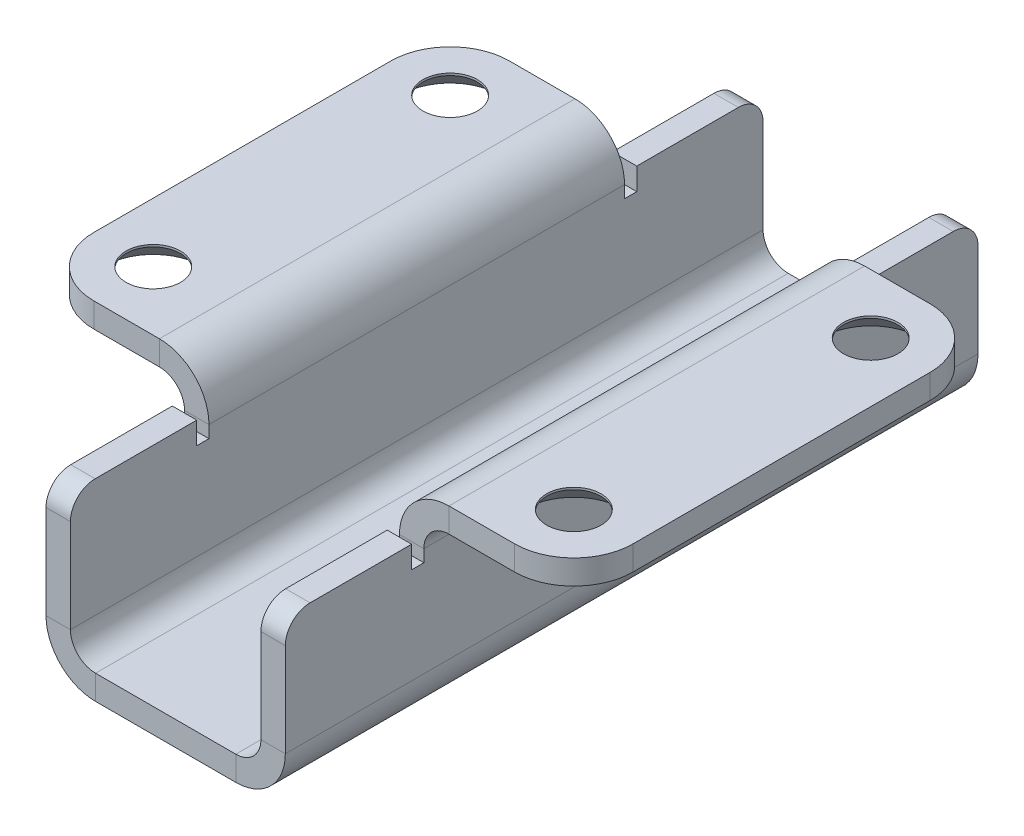
from build123d import *

# Parameters (mm, degrees)
SKETCH1_W                                     = 38.5
SKETCH1_H                                     = 140
BASE_FLANGE1_DEPTH                            = 4.93522
EDGE_FLANGE1_STRIP_W                          = 29.90088
EDGE_FLANGE1_STRIP_H                          = 4.93522
EDGE_FLANGE1_STRIP_CUT_DEPTH                  = 140
EDGE_FLANGE1_DEPTH                            = 140
EDGE_FLANGE2_STRIP_W                          = 29.90088
EDGE_FLANGE2_STRIP_H                          = 4.93522
EDGE_FLANGE2_STRIP_CUT_DEPTH                  = 84
EDGE_FLANGE2_RELIEF_W                         = 32.36849
EDGE_FLANGE2_RELIEF_H                         = 2.46761
EDGE_FLANGE2_RELIEF_CUT_DEPTH                 = 4.93522
EDGE_FLANGE2_DEPTH                            = 84
FILLET1_R                                     = 12
CUT_EXTRUDE1_REACH                            = 92.308
SKETCH20_W                                    = 25.53239
SKETCH20_H                                    = 8
FILLET2_R                                     = 5
FILLET1_OF_MIRROR1_R                          = 12
FILLET2_OF_MIRROR1_R                          = 5
CSK_FOR_M10_FLAT_HEAD_MACHINE_SCREW1_AT_COUNT = 2
CSK_FOR_M10_FLAT_HEAD_MACHINE_SCREW1_AT_PITCH = 52.021630117
CSK_FOR_M10_FLAT_HEAD_MACHINE_SCREW1_2_COUNT  = 2
CSK_FOR_M10_FLAT_HEAD_MACHINE_SCREW1_2_PITCH  = 104.043260233
CSK_FOR_M10_FLAT_HEAD_MACHINE_SCREW1_3_COUNT  = 2
CSK_FOR_M10_FLAT_HEAD_MACHINE_SCREW1_3_PITCH  = 85
CSK_FOR_M10_FLAT_HEAD_MACHINE_SCREW1_4_COUNT  = 2
CSK_FOR_M10_FLAT_HEAD_MACHINE_SCREW1_4_PITCH  = 60


# Sheet-metal steps are written as plain solids
with BuildPart() as part:
    # Sketch1 → Base-Flange1 (new body)
    with BuildSketch(Plane(origin=(0, 0, 0), x_dir=(1, 0, 0), z_dir=(0, 1, 0))):
        Rectangle(SKETCH1_W, SKETCH1_H)
    extrude(amount=-BASE_FLANGE1_DEPTH)

    # Edge-Flange1 strip (across the edge) → Edge-Flange1 strip cut (cut)
    with BuildSketch(Plane(origin=(-19.25, 0, -70), x_dir=(1, 0, 0), z_dir=(0, 0, 1))):
        with Locations((-9.87044, -2.46761)):
            Rectangle(EDGE_FLANGE1_STRIP_W, EDGE_FLANGE1_STRIP_H)
    edge_flange1_strip_cut = extrude(amount=EDGE_FLANGE1_STRIP_CUT_DEPTH, mode=Mode.SUBTRACT)

    # Edge-Flange1 section (across the edge) → Edge-Flange1 (add)
    with BuildSketch(Plane(origin=(-19.25, 0, -70), x_dir=(1, 0, 0), z_dir=(0, 0, 1))):
        with BuildLine():
            Line((-4.93522, 5.08), (-4.93522, 37))
            Line((-4.93522, 37), (0, 37))
            Line((0, 37), (0, 5.08))
            ThreePointArc((0, 5.08), (1.487897552, 1.487897552), (5.08, 0))
            Line((5.08, 0), (5.08, -4.93522))
            ThreePointArc((5.08, -4.93522), (-2.001829977, -2.001829977), (-4.93522, 5.08))
        make_face()
    edge_flange1 = extrude(amount=EDGE_FLANGE1_DEPTH)

    # Edge-Flange2 strip (across the edge) → Edge-Flange2 strip cut (cut)
    with BuildSketch(Plane(origin=(-24.18522, 37, 42), x_dir=(0, -1, 0), z_dir=(0, 0, -1))):
        with Locations((-4.93522, -2.46761)):
            Rectangle(EDGE_FLANGE2_STRIP_W, EDGE_FLANGE2_STRIP_H)
    edge_flange2_strip_cut = extrude(amount=EDGE_FLANGE2_STRIP_CUT_DEPTH, mode=Mode.SUBTRACT)

    # Edge-Flange2 relief (on the sheet) → Edge-Flange2 relief cut (cut)
    with BuildSketch(Plane(origin=(-24.18522, 26.98478, 42), x_dir=(0, -1, 0), z_dir=(-1, 0, 0))):
        with Locations((-13.716635, 1.233805)):
            Rectangle(EDGE_FLANGE2_RELIEF_W, EDGE_FLANGE2_RELIEF_H)
        with Locations((-13.716635, -85.233805)):
            Rectangle(EDGE_FLANGE2_RELIEF_W, EDGE_FLANGE2_RELIEF_H)
    edge_flange2_relief_cut = extrude(amount=-EDGE_FLANGE2_RELIEF_CUT_DEPTH, mode=Mode.SUBTRACT)

    # Edge-Flange2 section (across the edge) → Edge-Flange2 (add)
    with BuildSketch(Plane(origin=(-24.18522, 37, 42), x_dir=(0, -1, 0), z_dir=(0, 0, -1))):
        with BuildLine():
            Line((0, 5.08), (0, 30.31478))
            Line((0, 30.31478), (4.93522, 30.31478))
            Line((4.93522, 30.31478), (4.93522, 5.08))
            ThreePointArc((4.93522, 5.08), (6.423117552, 1.487897552), (10.01522, 0))
            Line((10.01522, 0), (10.01522, -4.93522))
            ThreePointArc((10.01522, -4.93522), (2.933390023, -2.001829977), (0, 5.08))
        make_face()
    edge_flange2 = extrude(amount=EDGE_FLANGE2_DEPTH)

    # Fillet1
    fillet1_edges = [part.edges().sort_by_distance(p)[0] for p in [
        (-54.5, 34.53239, 42),
        (-54.5, 34.53239, -42),
    ]]
    fillet(fillet1_edges, radius=FILLET1_R)

    # Sketch20 → Cut-Extrude1 (cut, up to next)
    with BuildSketch(Plane.ZY.offset(24.18522), mode=Mode.PRIVATE) as cut_extrude1_sk1:
        with Locations((-57.233805, 33)):
            Rectangle(SKETCH20_W, SKETCH20_H)
    cut_extrude1_tool1 = extrude(cut_extrude1_sk1.sketch, amount=-CUT_EXTRUDE1_REACH, mode=Mode.PRIVATE) & part.part
    # Sketch20 → Cut-Extrude1 (cut, up to next)
    with BuildSketch(Plane.ZY.offset(24.18522), mode=Mode.PRIVATE) as cut_extrude1_sk2:
        with Locations((57.233805, 33)):
            Rectangle(SKETCH20_W, SKETCH20_H)
    cut_extrude1_tool2 = extrude(cut_extrude1_sk2.sketch, amount=-CUT_EXTRUDE1_REACH, mode=Mode.PRIVATE) & part.part
    cut_extrude1_1 = cut_extrude1_tool1.solids().sort_by_distance((-24.18522, 33, -57.233805))[0]
    add(cut_extrude1_1, mode=Mode.SUBTRACT)
    cut_extrude1_2 = cut_extrude1_tool2.solids().sort_by_distance((-24.18522, 33, 57.233805))[0]
    add(cut_extrude1_2, mode=Mode.SUBTRACT)
    cut_extrude1 = cut_extrude1_1 + cut_extrude1_2  # Cut-Extrude1 as one shape, for the pattern or mirror that repeats it

    # Fillet2
    fillet2_edges = [part.edges().sort_by_distance(p)[0] for p in [
        (-21.71761, 29, -70),
        (-21.71761, 29, 70),
    ]]
    fillet(fillet2_edges, radius=FILLET2_R)

    # Mirror1: Edge-Flange1 strip cut, Edge-Flange1, Edge-Flange2 strip cut, Edge-Flange2 relief cut, Edge-Flange2, Cut-Extrude1 across plane
    add(edge_flange1_strip_cut.mirror(Plane(origin=(0, 0, 0), x_dir=(0, 0, 1), z_dir=(1, 0, 0))), mode=Mode.SUBTRACT)
    add(edge_flange1.mirror(Plane(origin=(0, 0, 0), x_dir=(0, 0, 1), z_dir=(1, 0, 0))))
    add(edge_flange2_strip_cut.mirror(Plane(origin=(0, 0, 0), x_dir=(0, 0, 1), z_dir=(1, 0, 0))), mode=Mode.SUBTRACT)
    add(edge_flange2_relief_cut.mirror(Plane(origin=(0, 0, 0), x_dir=(0, 0, 1), z_dir=(1, 0, 0))), mode=Mode.SUBTRACT)
    add(edge_flange2.mirror(Plane(origin=(0, 0, 0), x_dir=(0, 0, 1), z_dir=(1, 0, 0))))
    add(cut_extrude1.mirror(Plane(origin=(0, 0, 0), x_dir=(0, 0, 1), z_dir=(1, 0, 0))), mode=Mode.SUBTRACT)

    # Fillet1 of Mirror1
    fillet1_of_mirror1_edges = [part.edges().sort_by_distance(p)[0] for p in [
        (54.5, 34.53239, 42),
        (54.5, 34.53239, -42),
    ]]
    fillet(fillet1_of_mirror1_edges, radius=FILLET1_OF_MIRROR1_R)

    # Fillet2 of Mirror1
    fillet2_of_mirror1_edges = [part.edges().sort_by_distance(p)[0] for p in [
        (21.71761, 29, -70),
        (21.71761, 29, 70),
    ]]
    fillet(fillet2_of_mirror1_edges, radius=FILLET2_OF_MIRROR1_R)

    # Sketch30 → CSK for M10 Flat Head Machine Screw1 (revolve, cut)
    with BuildSketch(Plane(origin=(42.5, 32.06478, 30), x_dir=(0, 0, -1), z_dir=(1, 0, 0))):
        Polygon((0, 0), (0, 4.93522), (5.5, 4.93522), (5.5, 4.5), (10, 0), align=None)
    csk_for_m10_flat_head_machine_screw1 = revolve(axis=Axis((42.5, 25.71478, 30), (0, 1, 0)), mode=Mode.SUBTRACT)

    # CSK for M10 Flat Head Machine Screw1 at: CSK for M10 Flat Head Machine Screw1 ×2
    with Locations(*[Vector(-0.8169678632647617, 0, -0.5766831975986554) * (i * CSK_FOR_M10_FLAT_HEAD_MACHINE_SCREW1_AT_PITCH) for i in range(1, CSK_FOR_M10_FLAT_HEAD_MACHINE_SCREW1_AT_COUNT)]):
        add(csk_for_m10_flat_head_machine_screw1, mode=Mode.SUBTRACT)

    # CSK for M10 Flat Head Machine Screw1 2: CSK for M10 Flat Head Machine Screw1 ×2
    with Locations(*[Vector(-0.8169678632647617, 0, -0.5766831975986554) * (i * CSK_FOR_M10_FLAT_HEAD_MACHINE_SCREW1_2_PITCH) for i in range(1, CSK_FOR_M10_FLAT_HEAD_MACHINE_SCREW1_2_COUNT)]):
        add(csk_for_m10_flat_head_machine_screw1, mode=Mode.SUBTRACT)

    # CSK for M10 Flat Head Machine Screw1 3: CSK for M10 Flat Head Machine Screw1 ×2
    with Locations(*[(-i * CSK_FOR_M10_FLAT_HEAD_MACHINE_SCREW1_3_PITCH, 0, 0) for i in range(1, CSK_FOR_M10_FLAT_HEAD_MACHINE_SCREW1_3_COUNT)]):
        add(csk_for_m10_flat_head_machine_screw1, mode=Mode.SUBTRACT)

    # CSK for M10 Flat Head Machine Screw1 4: CSK for M10 Flat Head Machine Screw1 ×2
    with Locations(*[(0, 0, -i * CSK_FOR_M10_FLAT_HEAD_MACHINE_SCREW1_4_PITCH) for i in range(1, CSK_FOR_M10_FLAT_HEAD_MACHINE_SCREW1_4_COUNT)]):
        add(csk_for_m10_flat_head_machine_screw1, mode=Mode.SUBTRACT)


solid = part.part
